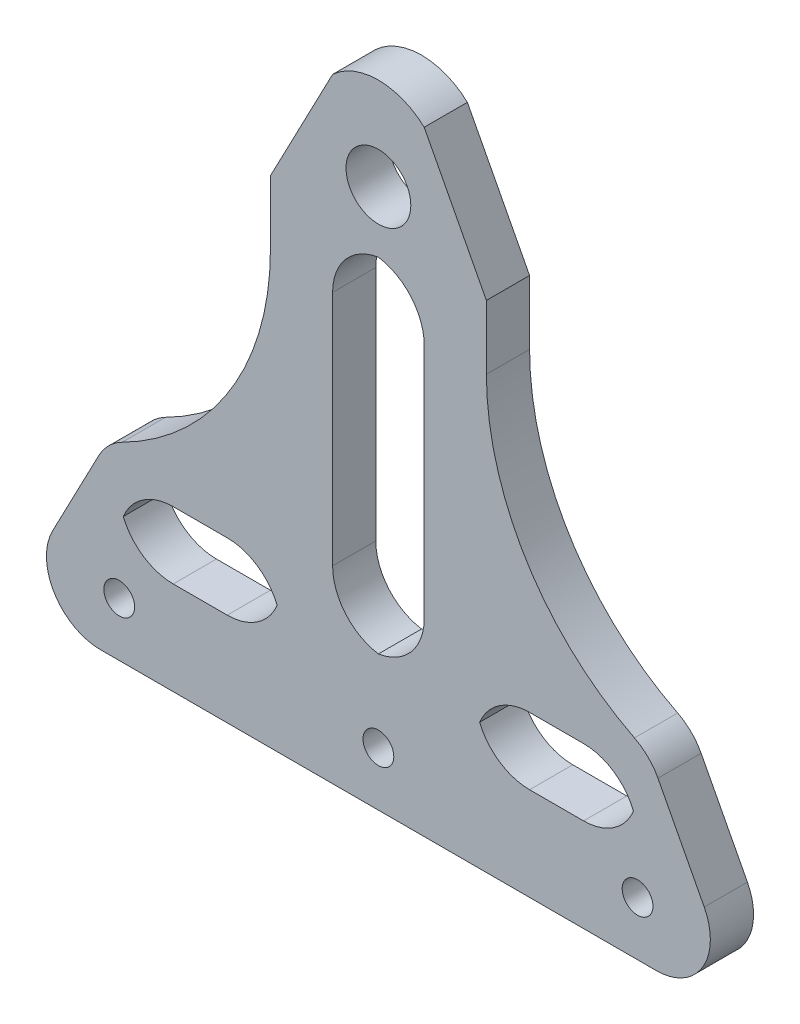
from build123d import *

# Parameters (mm, degrees)
SKETCH1_W           = 8.482282434
SKETCH1_H           = 31.931379298
SKETCH1_R           = 3
SKETCH1_W_2         = 15
SKETCH1_H_2         = 6.200324761
SKETCH1_R_2         = 1.425
BOSS_EXTRUDE1_DEPTH = 4
FILLET3_R           = 25
FILLET4_R           = 5


with BuildPart() as part:
    # Sketch1 → Boss-Extrude1 (new body)
    with BuildSketch(Plane.XY):
        with BuildLine():
            ThreePointArc((4.241141217, 39.891935908), (0, 41.554196678), (-4.241141217, 39.891935908))
            Line((-4.241141217, 39.891935908), (-10, 28.882352941))
            Line((-10, 28.882352941), (-10, 0))
            Line((-10, 0), (-25.107692308, 0))
            Line((-25.107692308, 0), (-34, -17))
            Line((-34, -17), (34, -17))
            Line((34, -17), (25.107692308, 0))
            Line((25.107692308, 0), (10, 0))
            Line((10, 0), (10, 28.882352941))
            Line((10, 28.882352941), (4.241141217, 39.891935908))
        make_face()
        with Locations((0, 11.439217567)):
            Rectangle(SKETCH1_W, SKETCH1_H, mode=Mode.SUBTRACT)
        with Locations((0, 33)):
            Circle(SKETCH1_R, mode=Mode.SUBTRACT)
        with Locations((16.5, -5.259184167)):
            Rectangle(SKETCH1_W_2, SKETCH1_H_2, mode=Mode.SUBTRACT)
        with Locations((24, -12)):
            Circle(SKETCH1_R_2, mode=Mode.SUBTRACT)
        with Locations((-24, -12)):
            Circle(SKETCH1_R_2, mode=Mode.SUBTRACT)
        with Locations((-16.5, -5.259184167)):
            Rectangle(SKETCH1_W_2, SKETCH1_H_2, mode=Mode.SUBTRACT)
        with Locations((0, -12)):
            Circle(SKETCH1_R_2, mode=Mode.SUBTRACT)
    extrude(amount=BOSS_EXTRUDE1_DEPTH)

    # Fillet3
    # the kernel refuses this fillet: 25 mm, written as the material it adds along each edge
    with BuildSketch(Plane(origin=(10, 0, 0), x_dir=(1, 0, 0), z_dir=(0, 0, 1))) as fillet3_piece_1:
        with BuildLine():
            CenterArc((25, 22.959578579), FILLET3_R, 180, 66.690841486)
            Line((0, 22.959578579), (-0.5, 22.959578579))
            Line((-0.5, 22.959578579), (-0.5, 0))
            Line((-0.5, 0), (0, -0.5))
            ThreePointArc((0, -0.5), (7.553846154, -0.5), (14.909846154, -0.459191572))
            Line((14.909846154, -0.459191572), (15.107692308, 0))
        make_face()
    extrude(amount=4)
    with BuildSketch(Plane(origin=(-10, 0, 0), x_dir=(0, 1, 0), z_dir=(0, 0, 1))) as fillet3_piece_2:
        with BuildLine():
            CenterArc((22.959578579, 25), FILLET3_R, 203.309158514, 66.690841486)
            Line((0, 15.107692308), (-0.459191572, 14.909846154))
            ThreePointArc((-0.459191572, 14.909846154), (-0.5, 7.553846154), (-0.5, 0))
            Line((-0.5, 0), (0, -0.5))
            Line((0, -0.5), (22.959578579, -0.5))
            Line((22.959578579, -0.5), (22.959578579, 0))
        make_face()
    extrude(amount=4)

    # Fillet4
    # the kernel refuses this fillet: 5 mm, written as the material it adds along each edge
    with BuildSketch(Plane(origin=(4.241141217, -4.526472082, 0), x_dir=(0, 1, 0), z_dir=(0, 0, 1)), Plane(origin=(4.241141217, 27.404907216, 0), x_dir=(-1, 0, 0), z_dir=(0, 0, 1)), Plane(origin=(-24, -2.159021786, 0), x_dir=(0, -1, 0), z_dir=(0, 0, 1)), Plane(origin=(-9, -2.159021786, 0), x_dir=(-1, 0, 0), z_dir=(0, 0, 1)), Plane(origin=(9, -8.359346547, 0), x_dir=(1, 0, 0), z_dir=(0, 0, 1)), Plane(origin=(9, -2.159021786, 0), x_dir=(0, -1, 0), z_dir=(0, 0, 1))) as fillet4_piece_1:
        with BuildLine():
            CenterArc((FILLET4_R, FILLET4_R), FILLET4_R, 180, 90)
            Line((0, FILLET4_R), (0, 0))
            Line((0, 0), (FILLET4_R, 0))
        make_face()
    extrude(amount=4)
    with BuildSketch(Plane(origin=(-4.241141217, -4.526472082, 0), x_dir=(0, 1, 0), z_dir=(0, 0, 1)), Plane(origin=(-4.241141217, 27.404907216, 0), x_dir=(1, 0, 0), z_dir=(0, 0, 1)), Plane(origin=(-24, -8.359346547, 0), x_dir=(0, 1, 0), z_dir=(0, 0, 1)), Plane(origin=(-9, -8.359346547, 0), x_dir=(-1, 0, 0), z_dir=(0, 0, 1)), Plane(origin=(24, -8.359346547, 0), x_dir=(-1, 0, 0), z_dir=(0, 0, 1)), Plane(origin=(24, -2.159021786, 0), x_dir=(0, -1, 0), z_dir=(0, 0, 1))) as fillet4_piece_2:
        with BuildLine():
            CenterArc((FILLET4_R, -FILLET4_R), FILLET4_R, 90, 90)
            Line((0, -FILLET4_R), (0, 0))
            Line((0, 0), (FILLET4_R, 0))
        make_face()
    extrude(amount=4)
    # the kernel refuses this fillet: 5 mm, written as the material it takes off along each edge
    with BuildSketch(Plane(origin=(34, -17, -20.64524995), x_dir=(-1, 0, 0), z_dir=(0, 0, 1)), Plane(origin=(-34, -17, -20.64524995), x_dir=(0.46349752669999783, 0.88609821280882, 0), z_dir=(0, 0, 1))) as fillet4_2_piece_1:
        with BuildLine():
            CenterArc((FILLET4_R * 1.65161999601, -FILLET4_R), FILLET4_R, 90, 117.613027823)
            Line((FILLET4_R * 0.765521783197, -FILLET4_R * 1.4634975267), (0, 0))
            Line((0, 0), (FILLET4_R * 1.65161999601, 0))
        make_face()
    extrude(amount=45.2904999, mode=Mode.SUBTRACT)
    with BuildSketch(Plane(origin=(25.107692308, 0, -4.210996565), x_dir=(-0.9057801330120623, 0.42374798010214837, 0), z_dir=(0, 0, 1))) as fillet4_2_piece_2:
        with BuildLine():
            CenterArc((1.691402393, 4.997635108), FILLET4_R, 232.68446816, 35.553250017)
            Line((-1.339617689, 1.021089212), (0, 0))
            ThreePointArc((0, 0), (0.768819269, 0.011824458), (1.537638539, 0))
        make_face()
    extrude(amount=12.421993131, mode=Mode.SUBTRACT)
    with BuildSketch(Plane(origin=(-25.107692308, 0, -4.210996565), x_dir=(0.9057801330120621, 0.4237479801021487, 0), z_dir=(0, 0, 1))) as fillet4_2_piece_3:
        with BuildLine():
            CenterArc((1.691402393, -4.997635108), FILLET4_R, 91.762281823, 35.553250017)
            Line((-1.339617689, -1.021089212), (0, 0))
            ThreePointArc((0, 0), (0.768819269, -0.011824458), (1.537638539, 0))
        make_face()
    extrude(amount=12.421993131, mode=Mode.SUBTRACT)


solid = part.part
